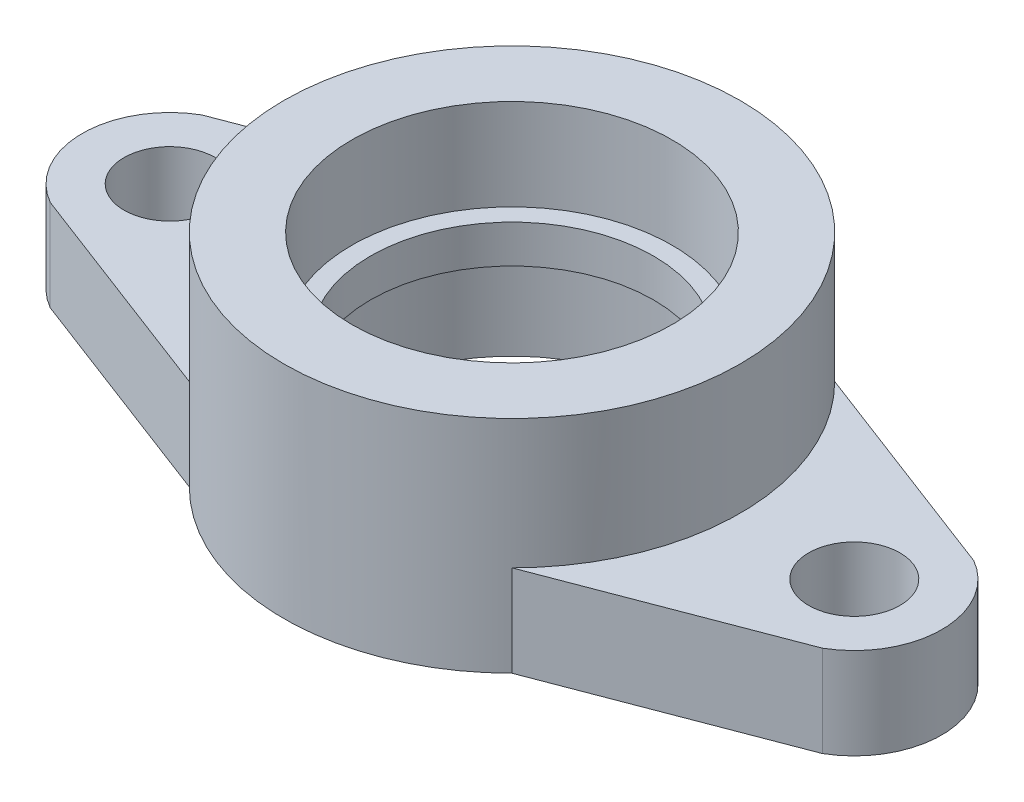
from build123d import *

# Parameters (mm, degrees)
BOSS_EXTRUDE2_DEPTH  = 12
BOSS_EXTRUDE3_DEPTH  = 17
MIRROR12_DEPTH       = 29
MIRROR12_2_OUTLINE_R = 6
MIRROR12_2_DEPTH     = 12
SKETCH4_R            = 21.05
CUT_EXTRUDE1_DEPTH   = 12
SKETCH5_R            = 18.6
CUT_EXTRUDE2_DEPTH   = 5


# Read off the part's stored shape, not the designer's step: Mirror12
with BuildPart() as part:
    # Sketch1 → Boss-Extrude2 (new body)
    with BuildSketch(Plane(origin=(0, 0, 0), x_dir=(1, 0, 0), z_dir=(0, 1, 0))):
        with BuildLine():
            Line((0, 30), (0, 0))
            Line((0, 0), (39, 0))
            ThreePointArc((39, 0), (45, 6), (51, 0))
            Line((51, 0), (56.5, 0))
            ThreePointArc((56.5, 0), (54.959292144, 5.75), (50.75, 9.959292144))
            Line((50.75, 9.959292144), (21.213203436, 21.213203436))
            ThreePointArc((21.213203436, 21.213203436), (11.480502971, 27.716385975), (0, 30))
        make_face()
    extrude(amount=BOSS_EXTRUDE2_DEPTH)

    # Sketch3 → Boss-Extrude3 (add)
    with BuildSketch(Plane(origin=(0, 12, 0), x_dir=(1, 0, 0), z_dir=(0, 1, 0))):
        with BuildLine():
            Line((0, 30), (0, 0))
            Line((0, 0), (30, 0))
            ThreePointArc((30, 0), (21.213203436, 21.213203436), (0, 30))
        make_face()
    extrude(amount=BOSS_EXTRUDE3_DEPTH)

    # Mirror12 outline → Mirror12 (add)
    with BuildSketch(Plane(origin=(0, 0, 0), x_dir=(1, 0, 0), z_dir=(0, 1, 0))):
        with BuildLine():
            ThreePointArc((0, 30), (-21.213203436, -21.213203436), (30, 0))
            Line((30, 0), (0, 0))
            Line((0, 0), (0, 30))
        make_face()
    extrude(amount=MIRROR12_DEPTH)

    # Mirror12 2 outline → Mirror12 2 (add)
    # profile 1 of 2: a face of its own
    with BuildSketch(Plane(origin=(0, 0, 0), x_dir=(1, 0, 0), z_dir=(0, 1, 0))):
        with BuildLine():
            Line((56.5, 0), (51, 0))
            ThreePointArc((51, 0), (45, -6), (39, 0))
            Line((39, 0), (30, 0))
            ThreePointArc((30, 0), (27.716385975, -11.480502971), (21.213203436, -21.213203436))
            Line((21.213203436, -21.213203436), (50.75, -9.959292144))
            ThreePointArc((50.75, -9.959292144), (54.959292144, -5.75), (56.5, 0))
        make_face()
    # profile 2 of 2: a face of its own
    with BuildSketch(Plane(origin=(0, 0, 0), x_dir=(1, 0, 0), z_dir=(0, 1, 0))):
        with BuildLine():
            ThreePointArc((-21.213203436, -21.213203436), (-30, 0), (-21.213203436, 21.213203436))
            Line((-21.213203436, 21.213203436), (-50.75, 9.959292144))
            ThreePointArc((-50.75, 9.959292144), (-56.5, 0), (-50.75, -9.959292144))
            Line((-50.75, -9.959292144), (-21.213203436, -21.213203436))
        make_face()
        with Locations((-45, 0)):
            Circle(MIRROR12_2_OUTLINE_R, mode=Mode.SUBTRACT)
    extrude(amount=MIRROR12_2_DEPTH)

    # Sketch4 → Cut-Extrude1 (cut)
    with BuildSketch(Plane(origin=(0, 29, 0), x_dir=(1, 0, 0), z_dir=(0, 1, 0))):
        with Locations(Location((0, 0, 0), (0, 0, 270))):
            Circle(SKETCH4_R)
    cut_extrude1 = extrude(amount=-CUT_EXTRUDE1_DEPTH, mode=Mode.SUBTRACT)

    # Mirror13: Cut-Extrude1 across plane
    add(cut_extrude1.mirror(Plane.ZX.offset(14.5)), mode=Mode.SUBTRACT)

    # Sketch5 → Cut-Extrude2 (cut)
    with BuildSketch(Plane(origin=(0, 17, 0), x_dir=(1, 0, 0), z_dir=(0, 1, 0))):
        with Locations(Location((0, 0, 0), (0, 0, 270))):
            Circle(SKETCH5_R)
    extrude(amount=-CUT_EXTRUDE2_DEPTH, mode=Mode.SUBTRACT)


solid = part.part
